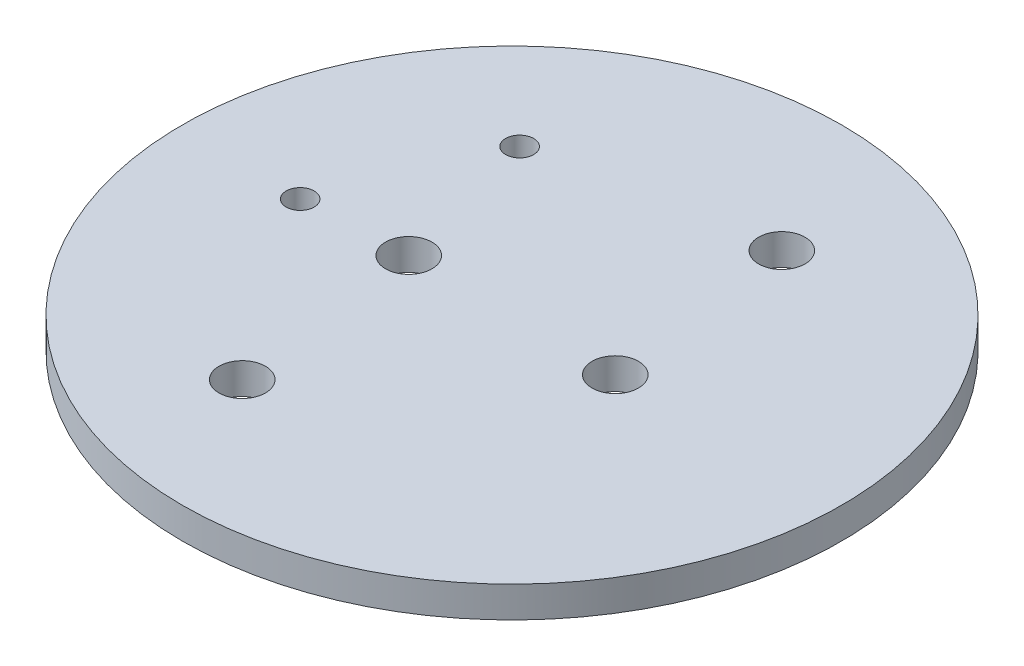
from build123d import *

# Parameters (mm, degrees)
SKETCH1_R                 = 50.673
SKETCH1_R_2               = 3.5687
BOSS_EXTRUDE1_DEPTH       = 4.7752
F_6_CLEARANCE_HOLE1_D     = 4.3053
F_6_CLEARANCE_HOLE1_DEPTH = 10.668
F_6_CLEARANCE_HOLE1_TIP   = 1.293442612


with BuildPart() as part:
    # Sketch1 → Boss-Extrude1 (new body)
    with BuildSketch(Plane(origin=(0, 0, 0), x_dir=(1, 0, 0), z_dir=(0, 1, 0))):
        Circle(SKETCH1_R)
        with Locations((12.150198978, 29.333175157)):
            Circle(SKETCH1_R_2, mode=Mode.SUBTRACT)
        with Locations((-12.150198978, -29.333175157)):
            Circle(SKETCH1_R_2, mode=Mode.SUBTRACT)
        with Locations((-15.875, 0)):
            Circle(SKETCH1_R_2, mode=Mode.SUBTRACT)
        with Locations((15.875, 0)):
            Circle(SKETCH1_R_2, mode=Mode.SUBTRACT)
    extrude(amount=BOSS_EXTRUDE1_DEPTH)

    # #6 Clearance Hole1
    with Locations(Plane(origin=(0, 4.7752, 0), x_dir=(1, 0, 0), z_dir=(0, 1, 0))):
        with Locations((-21.855257778, 23.03063628), (-31.739120068, -0.831118109)):
            Hole(F_6_CLEARANCE_HOLE1_D / 2, depth=F_6_CLEARANCE_HOLE1_DEPTH)
            with Locations((0, 0, -(F_6_CLEARANCE_HOLE1_DEPTH + F_6_CLEARANCE_HOLE1_TIP / 2))):  # 118° drill point
                Cone(0, F_6_CLEARANCE_HOLE1_D / 2, F_6_CLEARANCE_HOLE1_TIP, mode=Mode.SUBTRACT)


solid = part.part
